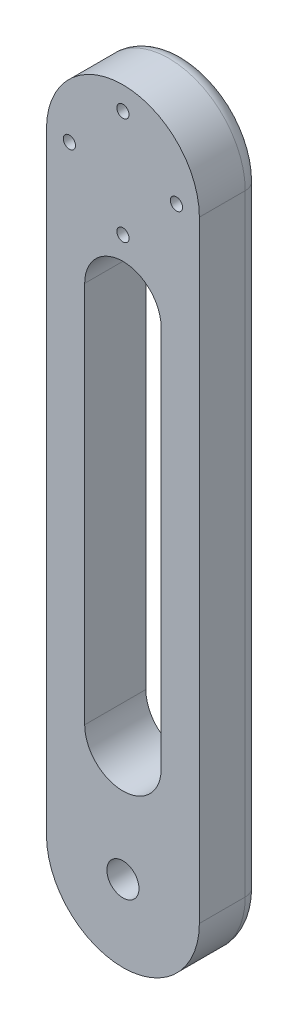
from build123d import *

# Parameters (mm, degrees)
SKETCH1_R           = 0.8
SKETCH1_R_2         = 2.1
BOSS_EXTRUDE1_DEPTH = 8
FILLET1_R           = 2
CUT_EXTRUDE1_DEPTH  = 60


with BuildPart() as part:
    # Sketch1 → Boss-Extrude1 (new body)
    with BuildSketch(Plane.XY):
        with BuildLine():
            Line((10, -80), (10, 0))
            ThreePointArc((10, 0), (0, 10), (-10, 0))
            Line((-10, 0), (-10, -80))
            ThreePointArc((-10, -80), (0, -90), (10, -80))
        make_face()
        with Locations((7, 0)):
            Circle(SKETCH1_R, mode=Mode.SUBTRACT)
        with Locations((-7, 0)):
            Circle(SKETCH1_R, mode=Mode.SUBTRACT)
        with Locations((0, 7)):
            Circle(SKETCH1_R, mode=Mode.SUBTRACT)
        with Locations((0, -7)):
            Circle(SKETCH1_R, mode=Mode.SUBTRACT)
        with Locations((0, -80)):
            Circle(SKETCH1_R_2, mode=Mode.SUBTRACT)
    extrude(amount=BOSS_EXTRUDE1_DEPTH)

    # Fillet1
    fillet1_edges = [part.edges().sort_by_distance(p)[0] for p in [
        (0, -90, 0),
        (0, 10, 0),
        (-10, -40, 0),
        (10, -40, 0),
    ]]
    fillet(fillet1_edges, radius=FILLET1_R)

    # Sketch3 → Cut-Extrude1 (cut)
    with BuildSketch(Plane(origin=(0, 0, 0), x_dir=(-1, 0, 0), z_dir=(0, 0, -1))):
        with BuildLine():
            Line((-5, -65), (-5, -15))
            ThreePointArc((-5, -15), (0, -10), (5, -15))
            Line((5, -15), (5, -65))
            ThreePointArc((5, -65), (0, -70), (-5, -65))
        make_face()
    extrude(amount=-CUT_EXTRUDE1_DEPTH, mode=Mode.SUBTRACT)


solid = part.part
